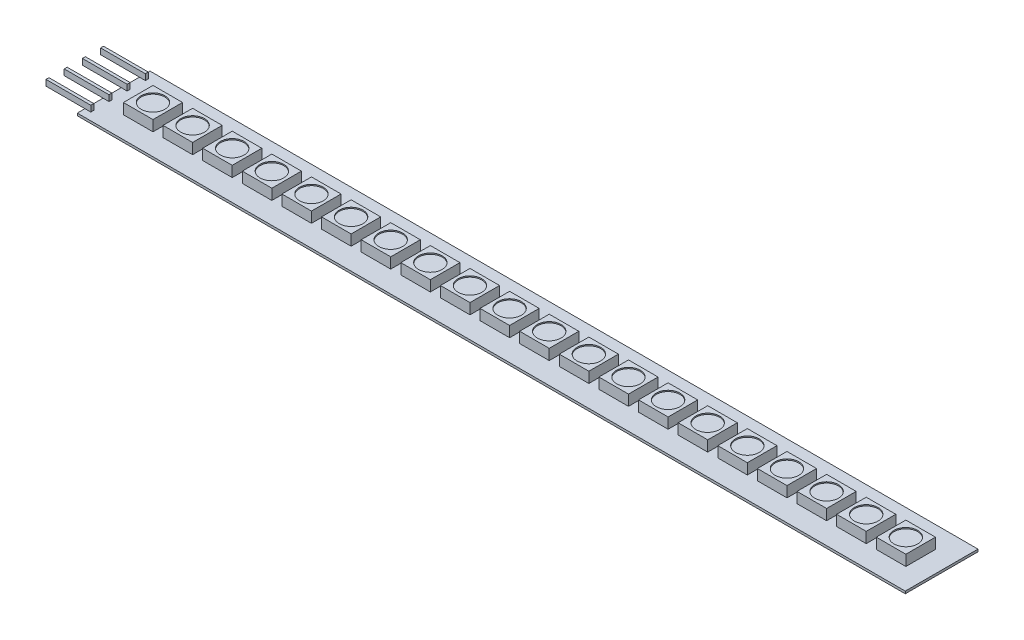
from build123d import *

# Parameters (mm, degrees)
SKETCH_1_W          = 140
SKETCH_1_H          = 12.3
EXTRUDE_1_DEPTH     = 0.4
SKETCH_2_W          = 5
SKETCH_2_H          = 5
EXTRUDE_2_DEPTH     = 1.8
SKETCH_3_R          = 2
CUT_EXTRUDE_1_DEPTH = 0.2
SKETCH_4_W          = 7.57602845
SKETCH_4_H          = 0.5
EXTRUDE_3_DEPTH     = 1


with BuildPart() as part:
    # 草圖1 → 填料-伸長1 (new body)
    with BuildSketch(Plane(origin=(0, 0, 0), x_dir=(1, 0, 0), z_dir=(0, 1, 0))):
        with Locations((70, 6.15)):
            Rectangle(SKETCH_1_W, SKETCH_1_H)
    extrude(amount=EXTRUDE_1_DEPTH)

    # 草圖2 → 填料-伸長2 (add)
    with BuildSketch(Plane(origin=(0, 0.4, 0), x_dir=(1, 0, 0), z_dir=(0, 1, 0))):
        with Locations((6.65, 6.15)):
            Rectangle(SKETCH_2_W, SKETCH_2_H)
        with Locations((13.35, 6.15)):
            Rectangle(SKETCH_2_W, SKETCH_2_H)
        with Locations((20.05, 6.15)):
            Rectangle(SKETCH_2_W, SKETCH_2_H)
        with Locations((26.75, 6.15)):
            Rectangle(SKETCH_2_W, SKETCH_2_H)
        with Locations((33.45, 6.15)):
            Rectangle(SKETCH_2_W, SKETCH_2_H)
        with Locations((40.15, 6.15)):
            Rectangle(SKETCH_2_W, SKETCH_2_H)
        with Locations((46.85, 6.15)):
            Rectangle(SKETCH_2_W, SKETCH_2_H)
        with Locations((53.55, 6.15)):
            Rectangle(SKETCH_2_W, SKETCH_2_H)
        with Locations((60.25, 6.15)):
            Rectangle(SKETCH_2_W, SKETCH_2_H)
        with Locations((66.95, 6.15)):
            Rectangle(SKETCH_2_W, SKETCH_2_H)
        with Locations((73.65, 6.15)):
            Rectangle(SKETCH_2_W, SKETCH_2_H)
        with Locations((80.35, 6.15)):
            Rectangle(SKETCH_2_W, SKETCH_2_H)
        with Locations((87.05, 6.15)):
            Rectangle(SKETCH_2_W, SKETCH_2_H)
        with Locations((93.75, 6.15)):
            Rectangle(SKETCH_2_W, SKETCH_2_H)
        with Locations((100.45, 6.15)):
            Rectangle(SKETCH_2_W, SKETCH_2_H)
        with Locations((107.15, 6.15)):
            Rectangle(SKETCH_2_W, SKETCH_2_H)
        with Locations((113.85, 6.15)):
            Rectangle(SKETCH_2_W, SKETCH_2_H)
        with Locations((120.55, 6.15)):
            Rectangle(SKETCH_2_W, SKETCH_2_H)
        with Locations((127.25, 6.15)):
            Rectangle(SKETCH_2_W, SKETCH_2_H)
        with Locations((133.95, 6.15)):
            Rectangle(SKETCH_2_W, SKETCH_2_H)
    extrude(amount=EXTRUDE_2_DEPTH)

    # 草圖3 → 除料-伸長1 (cut)
    with BuildSketch(Plane(origin=(0, 2.2, 0), x_dir=(1, 0, 0), z_dir=(0, 1, 0))):
        with Locations((6.65, 6.15)):
            Circle(SKETCH_3_R)
        with Locations((13.35, 6.15)):
            Circle(SKETCH_3_R)
        with Locations((20.05, 6.15)):
            Circle(SKETCH_3_R)
        with Locations((26.75, 6.15)):
            Circle(SKETCH_3_R)
        with Locations((33.45, 6.15)):
            Circle(SKETCH_3_R)
        with Locations((40.15, 6.15)):
            Circle(SKETCH_3_R)
        with Locations((46.85, 6.15)):
            Circle(SKETCH_3_R)
        with Locations((53.55, 6.15)):
            Circle(SKETCH_3_R)
        with Locations((60.25, 6.15)):
            Circle(SKETCH_3_R)
        with Locations((66.95, 6.15)):
            Circle(SKETCH_3_R)
        with Locations((73.65, 6.15)):
            Circle(SKETCH_3_R)
        with Locations((80.35, 6.15)):
            Circle(SKETCH_3_R)
        with Locations((87.05, 6.15)):
            Circle(SKETCH_3_R)
        with Locations((93.75, 6.15)):
            Circle(SKETCH_3_R)
        with Locations((100.45, 6.15)):
            Circle(SKETCH_3_R)
        with Locations((107.15, 6.15)):
            Circle(SKETCH_3_R)
        with Locations((113.85, 6.15)):
            Circle(SKETCH_3_R)
        with Locations((120.55, 6.15)):
            Circle(SKETCH_3_R)
        with Locations((127.25, 6.15)):
            Circle(SKETCH_3_R)
        with Locations((133.95, 6.15)):
            Circle(SKETCH_3_R)
    extrude(amount=-CUT_EXTRUDE_1_DEPTH, mode=Mode.SUBTRACT)

    # 草圖4 → 填料-伸長3 (add)
    with BuildSketch(Plane(origin=(0, 0.4, 0), x_dir=(1, 0, 0), z_dir=(0, 1, 0))):
        with Locations((-2.788014225, 10.7625)):
            Rectangle(SKETCH_4_W, SKETCH_4_H)
        with Locations((-2.788014225, 1.5375)):
            Rectangle(SKETCH_4_W, SKETCH_4_H)
        with Locations((-2.788014225, 4.6125)):
            Rectangle(SKETCH_4_W, SKETCH_4_H)
        with Locations((-2.788014225, 7.6875)):
            Rectangle(SKETCH_4_W, SKETCH_4_H)
    extrude(amount=EXTRUDE_3_DEPTH)


solid = part.part
